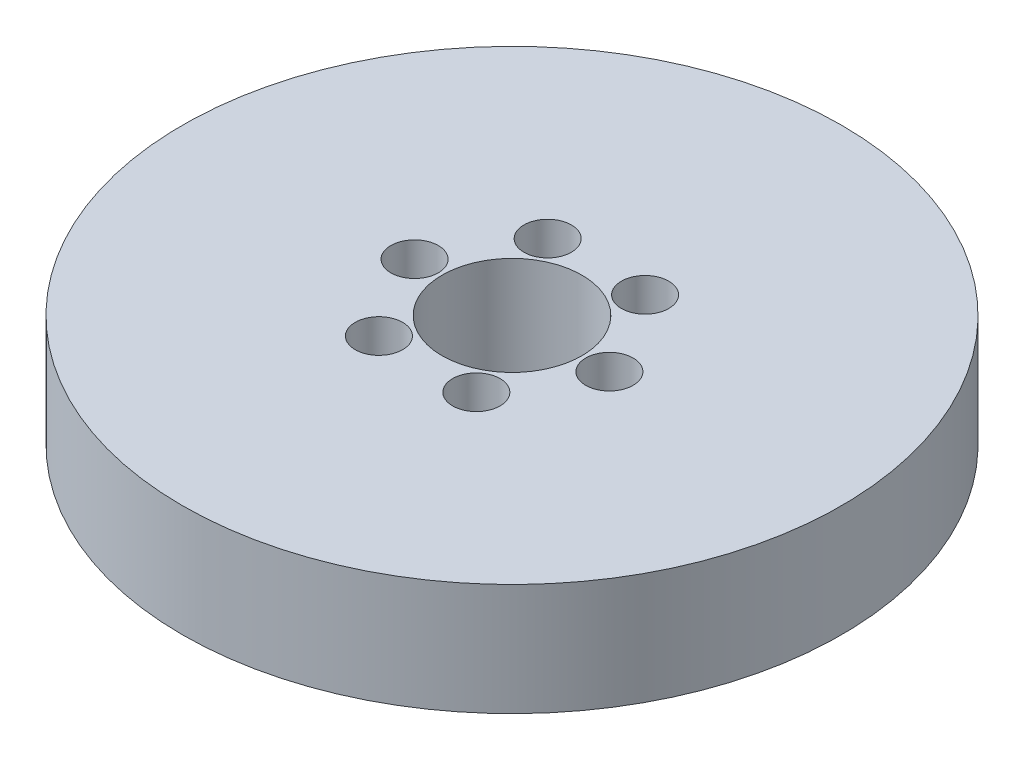
from build123d import *

# Parameters (mm, degrees)
SKETCH1_R           = 82.5
BOSS_EXTRUDE1_DEPTH = 28
SKETCH2_R           = 17.5
CUT_EXTRUDE1_DEPTH  = 120.98541578
SKETCH3_R           = 5.936641042
CUT_EXTRUDE2_DEPTH  = 18.467672158
CIRPATTERN1_COUNT   = 6


with BuildPart() as part:
    # Sketch1 → Boss-Extrude1 (new body)
    with BuildSketch(Plane(origin=(0, 0, 0), x_dir=(1, 0, 0), z_dir=(0, 1, 0))):
        Circle(SKETCH1_R)
    extrude(amount=BOSS_EXTRUDE1_DEPTH)

    # Sketch2 → Cut-Extrude1 (cut, through all)
    with BuildSketch(Plane(origin=(0, 0, 0), x_dir=(1, 0, 0), z_dir=(0, 1, 0))):
        Circle(SKETCH2_R)
    extrude(amount=CUT_EXTRUDE1_DEPTH, mode=Mode.SUBTRACT)

    # Sketch3 → Cut-Extrude2 (cut)
    with BuildSketch(Plane(origin=(0, 28, 0), x_dir=(1, 0, 0), z_dir=(0, 1, 0))):
        with Locations((-24.387329239, 0)):
            Circle(SKETCH3_R)
    cut_extrude2 = extrude(amount=-CUT_EXTRUDE2_DEPTH, mode=Mode.SUBTRACT)

    # CirPattern1: Cut-Extrude2 ×6 about axis
    cirpattern1_axis = Axis((0, 0, 0), (0, 1, 0))
    for i in range(1, CIRPATTERN1_COUNT):
        add(cut_extrude2.rotate(cirpattern1_axis, i * 360 / CIRPATTERN1_COUNT), mode=Mode.SUBTRACT)


solid = part.part
